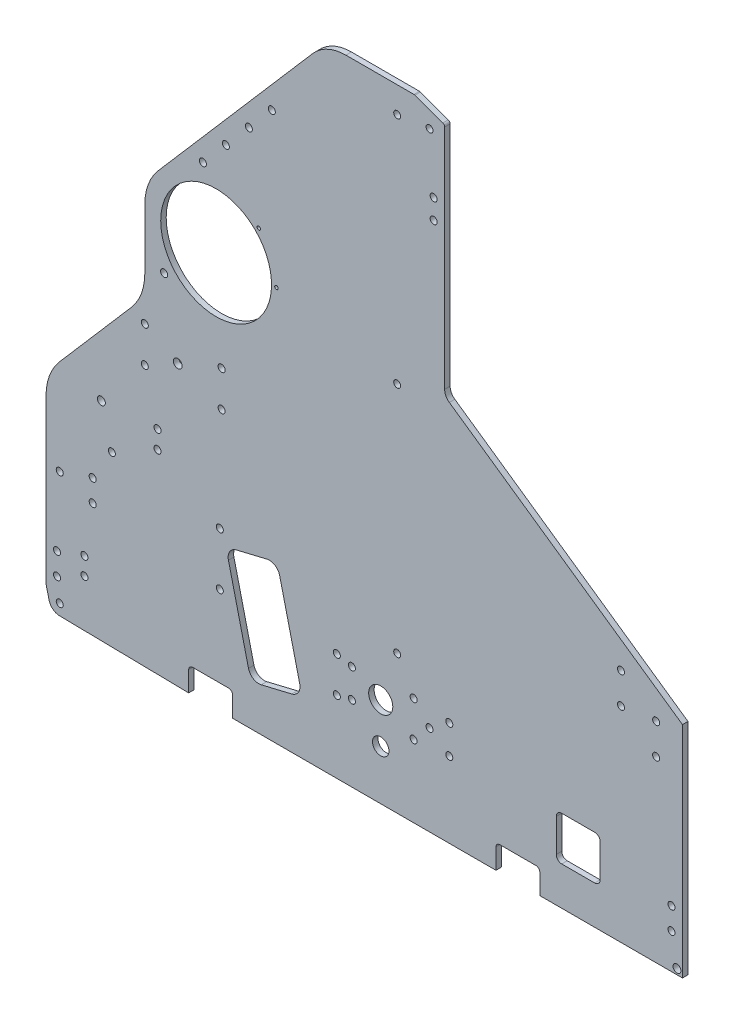
from build123d import *

# Parameters (mm, degrees)
SKETCH1_R           = 2.032
SKETCH1_R_2         = 2.54
SKETCH1_R_3         = 2
BOSS_EXTRUDE1_DEPTH = 3.175
FILLET1_R           = 2.286
FILLET2_R           = 6.35
SKETCH2_R           = 2.032
CUT_EXTRUDE1_DEPTH  = 505.524983177
FILLET3_R           = 1.5875
SKETCH3_R           = 2.032
SKETCH3_R_2         = 2.286
SKETCH3_R_3         = 1.016
CUT_EXTRUDE2_DEPTH  = 505.524983177
SKETCH4_R           = 2.032
SKETCH4_R_2         = 6.985
SKETCH4_R_3         = 4.7625
CUT_EXTRUDE3_DEPTH  = 505.524983177
SKETCH5_R           = 32.0675
SKETCH5_R_2         = 2.286
CUT_EXTRUDE5_DEPTH  = 540.282512269
FILLET4_R           = 31.75
CUT_EXTRUDE6_DEPTH  = 505.524983177
SKETCH7_R           = 2.032
CUT_EXTRUDE7_DEPTH  = 2.54
FILLET5_R           = 25.4


with BuildPart() as part:
    # Sketch1 → Boss-Extrude1 (new body)
    with BuildSketch(Plane.XY):
        with BuildLine():
            Line((7.829508682, -19.049081656), (82.55, -20.32))
            Line((82.55, -20.32), (82.55, -6.35))
            Line((82.55, -6.35), (107.95, -6.35))
            Line((107.95, -6.35), (107.95, -20.32))
            Line((107.95, -20.32), (260.35, -20.32))
            Line((260.35, -20.32), (260.35, -6.35))
            Line((260.35, -6.35), (285.75, -6.35))
            Line((285.75, -6.35), (285.75, -20.32))
            Line((285.75, -20.32), (368.3, -20.32))
            Line((368.3, -20.32), (368.3, 106.68))
            Line((368.3, 106.68), (230.66375, 202.565))
            Line((230.66375, 202.565), (230.66375, 338.455))
            Line((230.66375, 338.455), (213.19998, 344.805))
            Line((213.19998, 344.805), (203.2, 344.805))
            Line((203.2, 344.805), (161.925, 344.805))
            Line((161.925, 344.805), (52.720122664, 218.469945827))
            ThreePointArc((52.720122664, 218.469945827), (52.803835479, 218.142145922), (52.832, 217.805))
            ThreePointArc((52.832, 217.805), (52.095493096, 216.239521914), (50.419872403, 215.808871996))
            Line((50.419872403, 215.808871996), (0, 157.48))
            Line((0, 157.48), (0, 0))
            Line((0, 0), (0, -6.35))
            ThreePointArc((0, -6.35), (0.047577015, -7.125863724), (0.189595124, -7.890101219))
            Line((0.189595124, -7.890101219), (1.777095124, -14.240101219))
            ThreePointArc((1.777095124, -14.240101219), (3.987212552, -17.671692778), (7.829508682, -19.049081656))
        make_face()
        with Locations((7.9375, -12.7)):
            Circle(SKETCH1_R, mode=Mode.SUBTRACT)
        with Locations((6.35, 0)):
            Circle(SKETCH1_R, mode=Mode.SUBTRACT)
        with Locations((6.35, 12.7)):
            Circle(SKETCH1_R, mode=Mode.SUBTRACT)
        with Locations((38.1, 78.105)):
            Circle(SKETCH1_R, mode=Mode.SUBTRACT)
        with Locations((57.15, 131.28625)):
            Circle(SKETCH1_R, mode=Mode.SUBTRACT)
        with Locations((57.15, 151.92375)):
            Circle(SKETCH1_R, mode=Mode.SUBTRACT)
        with Locations((76.2, 141.605)):
            Circle(SKETCH1_R_2, mode=Mode.SUBTRACT)
        with Locations((101.6, 131.28625)):
            Circle(SKETCH1_R, mode=Mode.SUBTRACT)
        with Locations((101.6, 151.92375)):
            Circle(SKETCH1_R, mode=Mode.SUBTRACT)
        with Locations((203.2, 59.805)):
            Circle(SKETCH1_R_3, mode=Mode.SUBTRACT)
        with Locations((361.95, 0)):
            Circle(SKETCH1_R, mode=Mode.SUBTRACT)
        with Locations((361.95, 12.7)):
            Circle(SKETCH1_R, mode=Mode.SUBTRACT)
        with Locations((353.06, 82.955052336)):
            Circle(SKETCH1_R, mode=Mode.SUBTRACT)
        with Locations((332.74, 98.195052336)):
            Circle(SKETCH1_R, mode=Mode.SUBTRACT)
        with Locations((332.74, 115.975052336)):
            Circle(SKETCH1_R, mode=Mode.SUBTRACT)
        with Locations((353.06, 100.735052336)):
            Circle(SKETCH1_R, mode=Mode.SUBTRACT)
        with Locations((68.326, 182.923674932)):
            Circle(SKETCH1_R, mode=Mode.SUBTRACT)
        with Locations((76.2, 217.805)):
            Circle(SKETCH1_R, mode=Mode.SUBTRACT)
        with Locations((90.779500502, 249.682)):
            Circle(SKETCH1_R, mode=Mode.SUBTRACT)
        with Locations((104.067838673, 265.054783374)):
            Circle(SKETCH1_R, mode=Mode.SUBTRACT)
        with Locations((117.356176844, 280.427566748)):
            Circle(SKETCH1_R, mode=Mode.SUBTRACT)
        with Locations((130.644515014, 295.800350122)):
            Circle(SKETCH1_R, mode=Mode.SUBTRACT)
        with Locations((203.2, 194.805)):
            Circle(SKETCH1_R_3, mode=Mode.SUBTRACT)
        with Locations((224.31375, 287.401)):
            Circle(SKETCH1_R, mode=Mode.SUBTRACT)
        with Locations((224.31375, 298.831)):
            Circle(SKETCH1_R, mode=Mode.SUBTRACT)
        with Locations((203.2, 329.805)):
            Circle(SKETCH1_R_3, mode=Mode.SUBTRACT)
        with Locations((221.931865, 332.105)):
            Circle(SKETCH1_R_3, mode=Mode.SUBTRACT)
    extrude(amount=BOSS_EXTRUDE1_DEPTH)

    # Fillet1
    fillet1_edges = [part.edges().sort_by_distance(p)[0] for p in [
        (285.75, -6.35, 1.5875),
        (107.95, -6.35, 1.5875),
        (260.35, -6.35, 1.5875),
        (82.55, -6.35, 1.5875),
    ]]
    fillet(fillet1_edges, radius=FILLET1_R)

    # Fillet2
    fillet2_edges = [part.edges().sort_by_distance(p)[0] for p in [
        (230.66375, 202.565, 1.5875),
    ]]
    fillet(fillet2_edges, radius=FILLET2_R)

    # Sketch2 → Cut-Extrude1 (cut, through all)
    with BuildSketch(Plane(origin=(0, 0, 0), x_dir=(-1, 0, 0), z_dir=(0, 0, -1))):
        with Locations((-100.552770272, 71.086035298)):
            Circle(SKETCH2_R)
        with Locations((-100.552770272, 40.606035298)):
            Circle(SKETCH2_R)
        with Locations((-22.225, 18.202541089)):
            Circle(SKETCH2_R)
        with Locations((-22.225, 8.042541089)):
            Circle(SKETCH2_R)
    extrude(amount=-CUT_EXTRUDE1_DEPTH, mode=Mode.SUBTRACT)

    # Fillet3
    fillet3_edges = [part.edges().sort_by_distance(p)[0] for p in [
        (230.66375, 338.455, 1.5875),
        (213.19998, 344.805, 1.5875),
    ]]
    fillet(fillet3_edges, radius=FILLET3_R)

    # Sketch3 → Cut-Extrude2 (cut, through all)
    with BuildSketch(Plane.XY.offset(3.175)):
        with BuildLine():
            Line((127.789350211, 69.359774106), (110.090750339, 65.117184968))
            ThreePointArc((110.090750339, 65.117184968), (106.287939856, 62.356288953), (105.55119507, 57.715047577))
            Line((105.55119507, 57.715047577), (117.160037875, 9.287010566))
            ThreePointArc((117.160037875, 9.287010566), (119.92093389, 5.484200083), (124.562175266, 4.747455297))
            Line((124.562175266, 4.747455297), (142.260775137, 8.990044434))
            ThreePointArc((142.260775137, 8.990044434), (146.063585621, 11.75094045), (146.800330407, 16.392181825))
            Line((146.800330407, 16.392181825), (135.191487602, 64.820218836))
            ThreePointArc((135.191487602, 64.820218836), (132.430591586, 68.62302932), (127.789350211, 69.359774106))
        make_face()
        with Locations((26.987500002, 46.953113935)):
            Circle(SKETCH3_R)
        with Locations((26.987500002, 59.653113935)):
            Circle(SKETCH3_R)
        with Locations((7.937500002, 53.303113935)):
            Circle(SKETCH3_R)
        with Locations((32.030600738, 100.810868776)):
            Circle(SKETCH3_R_2)
        with Locations((64.525942114, 102.94048958)):
            Circle(SKETCH3_R)
        with Locations((64.525942114, 92.525786339)):
            Circle(SKETCH3_R)
        with Locations((133.35, 208.228121768)):
            Circle(SKETCH3_R_3)
        with Locations((123.120704333, 232.923826101)):
            Circle(SKETCH3_R_3)
    extrude(amount=-CUT_EXTRUDE2_DEPTH, mode=Mode.SUBTRACT)

    # Sketch4 → Cut-Extrude3 (cut, through all)
    with BuildSketch(Plane.XY.offset(3.175)):
        with Locations((168.275, 42.06875)):
            Circle(SKETCH4_R)
        with Locations((212.725, 42.06875)):
            Circle(SKETCH4_R)
        with Locations((212.725, 21.43125)):
            Circle(SKETCH4_R)
        with Locations((168.275, 21.43125)):
            Circle(SKETCH4_R)
        with Locations((193.675, 31.75)):
            Circle(SKETCH4_R_2)
        with Locations((177.00498, 40.0431)):
            Circle(SKETCH4_R)
        with Locations((177.00498, 23.4569)):
            Circle(SKETCH4_R)
        with Locations((193.675, 8.466666658)):
            Circle(SKETCH4_R_3)
        with Locations((221.931865, 31.75)):
            Circle(SKETCH4_R)
        with Locations((233.36123, 23.4569)):
            Circle(SKETCH4_R)
        with Locations((233.36123, 40.0431)):
            Circle(SKETCH4_R)
    extrude(amount=-CUT_EXTRUDE3_DEPTH, mode=Mode.SUBTRACT)

    # Sketch5 → Cut-Extrude5 (cut, through all)
    with BuildSketch(Plane(origin=(0, 0, -187.325000036), x_dir=(-1, 0, 0), z_dir=(0, 0, -1))):
        Polygon((0, 157.48), (-57.15, 223.594705882), (-57.15, 165.333696112), (0, 99.218990229), align=None)
        with Locations((-98.425, 208.228121768)):
            Circle(SKETCH5_R)
        with Locations((-365.124993902, -17.144956474)):
            Circle(SKETCH5_R_2)
    extrude(amount=-CUT_EXTRUDE5_DEPTH, mode=Mode.SUBTRACT)

    # Fillet4
    fillet4_edges = [part.edges().sort_by_distance(p)[0] for p in [
        (0, 99.218990229, 1.5875),
        (57.15, 165.333696112, 1.5875),
        (57.15, 223.594705882, 1.5875),
    ]]
    fillet(fillet4_edges, radius=FILLET4_R)

    # Sketch6 → Cut-Extrude6 (cut, through all)
    with BuildSketch(Plane.XY.offset(3.175)):
        with BuildLine():
            Line((298.45, 27.305), (317.5, 27.305))
            ThreePointArc((317.5, 27.305), (319.74506403, 26.37506403), (320.675, 24.13))
            Line((320.675, 24.13), (320.675, 5.08))
            ThreePointArc((320.675, 5.08), (319.74506403, 2.83493597), (317.5, 1.905))
            Line((317.5, 1.905), (298.45, 1.905))
            ThreePointArc((298.45, 1.905), (296.20493597, 2.83493597), (295.275, 5.08))
            Line((295.275, 5.08), (295.275, 24.13))
            ThreePointArc((295.275, 24.13), (296.20493597, 26.37506403), (298.45, 27.305))
        make_face()
    extrude(amount=-CUT_EXTRUDE6_DEPTH, mode=Mode.SUBTRACT)

    # Sketch7 → Cut-Extrude7 (cut)
    with BuildSketch(Plane(origin=(0, 0, 0), x_dir=(-1, 0, 0), z_dir=(0, 0, -1))):
        with Locations((-215.9, 306.705)):
            Circle(SKETCH7_R)
        with Locations((-203.2, 306.705)):
            Circle(SKETCH7_R)
        with Locations((-190.5, 306.705)):
            Circle(SKETCH7_R)
        with Locations((-177.8, 306.705)):
            Circle(SKETCH7_R)
        with Locations((-215.9, 255.905)):
            Circle(SKETCH7_R)
        with Locations((-203.2, 255.905)):
            Circle(SKETCH7_R)
        with Locations((-190.5, 255.905)):
            Circle(SKETCH7_R)
        with Locations((-177.8, 255.905)):
            Circle(SKETCH7_R)
    extrude(amount=-CUT_EXTRUDE7_DEPTH, mode=Mode.SUBTRACT)

    # Fillet5
    fillet5_edges = [part.edges().sort_by_distance(p)[0] for p in [
        (161.925, 344.805, 1.5875),
    ]]
    fillet(fillet5_edges, radius=FILLET5_R)


solid = part.part
